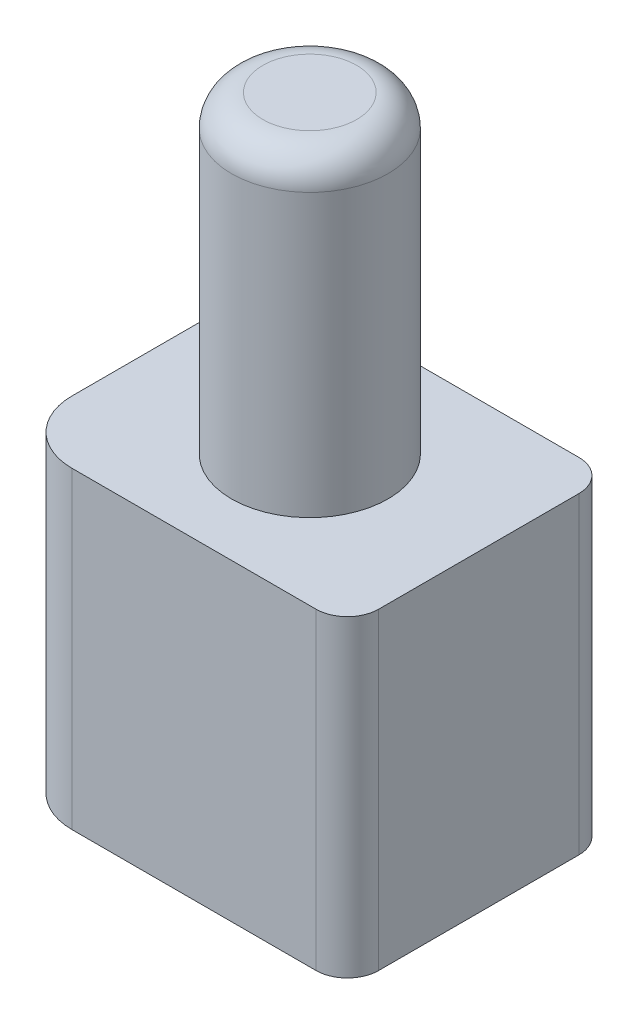
from build123d import *

# Parameters (mm, degrees)
SKETCH1_W           = 6.858
SKETCH1_H           = 5.334
BOSS_EXTRUDE1_DEPTH = 6.35
SKETCH4_W           = 1.397
SKETCH4_H           = 1.524
SKETCH4_W_2         = 1.524
SKETCH4_H_2         = 1.397
CUT_EXTRUDE1_DEPTH  = 3.556
SKETCH5_W           = 1.524
SKETCH5_H           = 1.143
BOSS_EXTRUDE4_DEPTH = 0.254
FILLET1_R           = 0.127
FILLET3_R           = 0.635
FILLET4_R           = 0.254
FILLET5_R           = 0.254
FILLET6_R           = 1.27
SKETCH6_R           = 1.5875
BOSS_EXTRUDE5_DEPTH = 6.35
FILLET8_R           = 0.635


with BuildPart() as part:
    # Sketch1 → Boss-Extrude1 (new body)
    with BuildSketch(Plane(origin=(0, 0, 0), x_dir=(1, 0, 0), z_dir=(0, 1, 0))):
        Rectangle(SKETCH1_W, SKETCH1_H)
    extrude(amount=BOSS_EXTRUDE1_DEPTH)

    # Sketch4 → Cut-Extrude1 (cut)
    with BuildSketch(Plane.XZ):
        with Locations((-1.4605, 0)):
            Rectangle(SKETCH4_W, SKETCH4_H)
        Rectangle(SKETCH4_W_2, SKETCH4_H)
        with Locations((1.4605, 0)):
            Rectangle(SKETCH4_W, SKETCH4_H)
        with Locations((0, -1.4605)):
            Rectangle(SKETCH4_W_2, SKETCH4_H_2)
        with Locations((0, 1.4605)):
            Rectangle(SKETCH4_W_2, SKETCH4_H_2)
    extrude(amount=-CUT_EXTRUDE1_DEPTH, mode=Mode.SUBTRACT)

    # Sketch5 → Boss-Extrude4 (add)
    with BuildSketch(Plane(origin=(0, 0, 2.159), x_dir=(-1, 0, 0), z_dir=(0, 0, -1))):
        with Locations((0, 2.3495)):
            Rectangle(SKETCH5_W, SKETCH5_H)
    extrude(amount=BOSS_EXTRUDE4_DEPTH)

    # Fillet1
    fillet1_edges = [part.edges().sort_by_distance(p)[0] for p in [
        (0, 1.778, 1.905),
        (0, 2.921, 1.905),
    ]]
    fillet(fillet1_edges, radius=FILLET1_R)

    # Fillet3
    fillet3_edges = [part.edges().sort_by_distance(p)[0] for p in [
        (3.429, 3.175, 2.667),
        (-3.429, 3.175, -2.667),
        (3.429, 3.175, -2.667),
    ]]
    fillet(fillet3_edges, radius=FILLET3_R)

    # Fillet4
    fillet4_edges = [part.edges().sort_by_distance(p)[0] for p in [
        (-1.4605, 0, -0.762),
        (-2.159, 0, 0),
        (0.762, 0, 1.4605),
        (1.4605, 0, -0.762),
        (0.762, 0, -1.4605),
        (0, 0, -2.159),
        (-0.762, 0, -1.4605),
        (2.159, 0, 0),
        (1.4605, 0, 0.762),
        (0, 0, 2.159),
        (-0.762, 0, 1.4605),
        (-1.4605, 0, 0.762),
    ]]
    fillet(fillet4_edges, radius=FILLET4_R)

    # Fillet5
    # the kernel refuses this fillet: 0.254 mm, written as the material it takes off along each edge
    with BuildSketch(Plane(origin=(1.016, 0.254, -1.016), x_dir=(0, 0, 1), z_dir=(-1, 0, 0))) as fillet5_piece_1_section:
        Polygon((0, 0), (FILLET5_R, 0), (FILLET5_R, -FILLET5_R), (0, -FILLET5_R), align=None)
    fillet5_piece_1 = extrude(amount=FILLET5_R, mode=Mode.PRIVATE)
    fillet5_piece_1 = fillet5_piece_1 - Plane(origin=(1.016, 0.254, -1.016), x_dir=(0, 0.7071067811865475, -0.7071067811865475), z_dir=(-1, 0, 0)) * Sphere(FILLET5_R, mode=Mode.PRIVATE)
    add(fillet5_piece_1, mode=Mode.SUBTRACT)
    with BuildSketch(Plane(origin=(1.016, 0.254, 1.016), x_dir=(0, 0, -1), z_dir=(-1, 0, 0))) as fillet5_piece_2_section:
        Polygon((0, 0), (FILLET5_R, 0), (FILLET5_R, FILLET5_R), (0, FILLET5_R), align=None)
    fillet5_piece_2 = extrude(amount=FILLET5_R, mode=Mode.PRIVATE)
    fillet5_piece_2 = fillet5_piece_2 - Plane(origin=(1.016, 0.254, 1.016), x_dir=(0, 0.7071067811865475, 0.7071067811865475), z_dir=(-1, 0, 0)) * Sphere(FILLET5_R, mode=Mode.PRIVATE)
    add(fillet5_piece_2, mode=Mode.SUBTRACT)
    with BuildSketch(Plane(origin=(-1.016, 0.254, -1.016), x_dir=(1, 0, 0), z_dir=(0, 0, 1))) as fillet5_piece_3_section:
        Polygon((0, 0), (FILLET5_R, 0), (FILLET5_R, -FILLET5_R), (0, -FILLET5_R), align=None)
    fillet5_piece_3 = extrude(amount=FILLET5_R, mode=Mode.PRIVATE)
    fillet5_piece_3 = fillet5_piece_3 - Plane(origin=(-1.016, 0.254, -1.016), x_dir=(-0.7071067811865475, 0.7071067811865475, 0), z_dir=(0, 0, 1)) * Sphere(FILLET5_R, mode=Mode.PRIVATE)
    add(fillet5_piece_3, mode=Mode.SUBTRACT)
    with BuildSketch(Plane(origin=(-1.016, 0.254, 1.016), x_dir=(1, 0, 0), z_dir=(0, 0, -1))) as fillet5_piece_4_section:
        Polygon((0, 0), (FILLET5_R, 0), (FILLET5_R, FILLET5_R), (0, FILLET5_R), align=None)
    fillet5_piece_4 = extrude(amount=FILLET5_R, mode=Mode.PRIVATE)
    fillet5_piece_4 = fillet5_piece_4 - Plane(origin=(-1.016, 0.254, 1.016), x_dir=(-0.7071067811865475, 0.7071067811865475, 0), z_dir=(0, 0, -1)) * Sphere(FILLET5_R, mode=Mode.PRIVATE)
    add(fillet5_piece_4, mode=Mode.SUBTRACT)
    with BuildSketch(Plane(origin=(-0.762, 0.254, -0.762), x_dir=(-1, 0, 0), z_dir=(0, 1, 0)), Plane(origin=(0.762, 0.254, -0.762), x_dir=(0, 0, -1), z_dir=(0, 1, 0))) as fillet5_piece_5:
        with BuildLine():
            CenterArc((FILLET5_R, -FILLET5_R), FILLET5_R, 90, 90)
            Line((0, -FILLET5_R), (0, 0))
            Line((0, 0), (FILLET5_R, 0))
        make_face()
    extrude(amount=3.302, mode=Mode.SUBTRACT)
    with BuildSketch(Plane(origin=(-0.762, 0.254, 0.762), x_dir=(-1, 0, 0), z_dir=(0, 1, 0)), Plane(origin=(0.762, 0.254, 0.762), x_dir=(0, 0, 1), z_dir=(0, 1, 0))) as fillet5_piece_6:
        with BuildLine():
            CenterArc((FILLET5_R, FILLET5_R), FILLET5_R, 180, 90)
            Line((0, FILLET5_R), (0, 0))
            Line((0, 0), (FILLET5_R, 0))
        make_face()
    extrude(amount=3.302, mode=Mode.SUBTRACT)

    # Fillet6
    fillet6_edges = [part.edges().sort_by_distance(p)[0] for p in [
        (-3.429, 3.175, 2.667),
    ]]
    fillet(fillet6_edges, radius=FILLET6_R)

    # Sketch6 → Boss-Extrude5 (add)
    with BuildSketch(Plane(origin=(0, 6.35, 0), x_dir=(1, 0, 0), z_dir=(0, 1, 0))):
        with Locations(Location((0, 0, 0), (0, 0, 270))):
            Circle(SKETCH6_R)
    extrude(amount=BOSS_EXTRUDE5_DEPTH)

    # Fillet8
    fillet8_edges = [part.edges().sort_by_distance(p)[0] for p in [
        (0, 12.7, -1.5875),
    ]]
    fillet(fillet8_edges, radius=FILLET8_R)


solid = part.part
